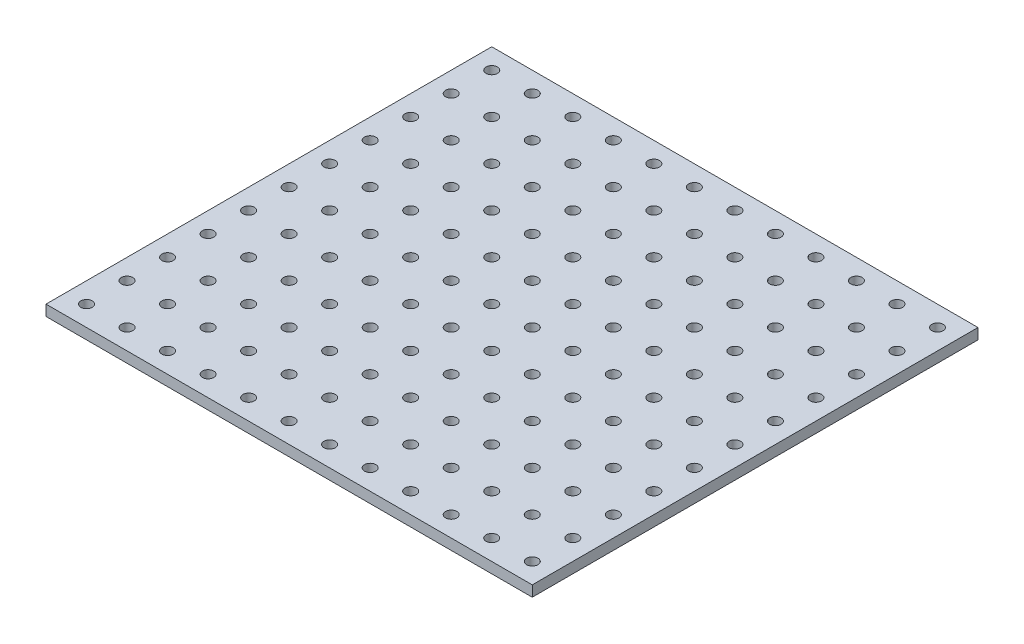
from build123d import *

# Parameters (mm, degrees)
SKETCH1_W            = 20
SKETCH1_H            = 20
SKETCH1_R            = 2.8
MAIN_SQUARE_DEPTH    = 5.5
SKETCH2_W            = 0.2
SKETCH2_H            = 0.2
ANTIWARPCUTS1_DEPTH  = 29.814059068
SKETCH3_W            = 0.2
SKETCH3_H            = 0.2
ANTIWARPCUTS2_DEPTH  = 29.814059068
LPATTERN2_COUNT      = 12
LPATTERN2_PITCH      = 20
LPATTERN2_COUNT_DIR2 = 11
LPATTERN2_PITCH_DIR2 = 20


with BuildPart() as part:
    # Sketch1 → Main Square (new body)
    with BuildSketch(Plane(origin=(0, 0, 0), x_dir=(1, 0, 0), z_dir=(0, 1, 0))):
        with Locations((10, 10)):
            Rectangle(SKETCH1_W, SKETCH1_H)
        with Locations((10, 10)):
            Circle(SKETCH1_R, mode=Mode.SUBTRACT)
    main_square = extrude(amount=MAIN_SQUARE_DEPTH)

    # Sketch2 → AntiWarpCuts1 (cut, symmetric)
    with BuildSketch(Plane.XY):
        with Locations((0.1, 0.1)):
            Rectangle(SKETCH2_W, SKETCH2_H)
        with Locations((19.9, 0.1)):
            Rectangle(SKETCH2_W, SKETCH2_H)
    antiwarpcuts1 = extrude(amount=ANTIWARPCUTS1_DEPTH, both=True, mode=Mode.SUBTRACT)

    # Sketch3 → AntiWarpCuts2 (cut, symmetric)
    with BuildSketch(Plane.ZY):
        with Locations((-0.1, 0.1)):
            Rectangle(SKETCH3_W, SKETCH3_H)
        with Locations((-19.9, 0.1)):
            Rectangle(SKETCH3_W, SKETCH3_H)
    antiwarpcuts2 = extrude(amount=ANTIWARPCUTS2_DEPTH, both=True, mode=Mode.SUBTRACT)

    # LPattern2: Main Square, AntiWarpCuts1, AntiWarpCuts2 12 × 11
    with Locations(*[(i * LPATTERN2_PITCH, 0, j * LPATTERN2_PITCH_DIR2) for i in range(LPATTERN2_COUNT) for j in range(LPATTERN2_COUNT_DIR2) if (i, j) != (0, 0)]):
        add(main_square)
        add(antiwarpcuts1, mode=Mode.SUBTRACT)
        add(antiwarpcuts2, mode=Mode.SUBTRACT)


solid = part.part
